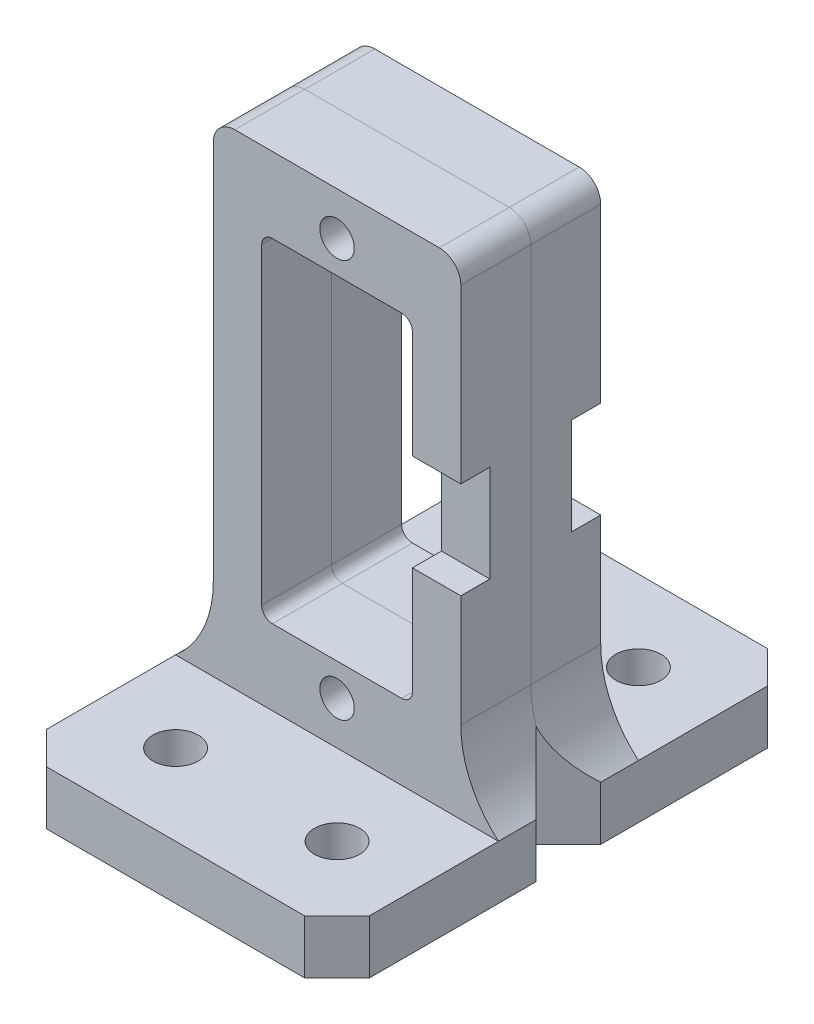
from build123d import *

# Parameters (mm, degrees)
SKETCH_1_W             = 14
SKETCH_1_H             = 31
EXTRUDE_1_DEPTH        = 6.5
SKETCH_2_W             = 30
SKETCH_2_H             = 5
EXTRUDE_2_DEPTH        = 15
SKETCH_3_W             = 4.5
SKETCH_3_H             = 9
CUT_EXTRUDE_1_DEPTH    = 2.7
SKETCH_4_R             = 1.6
CUT_EXTRUDE_2_DEPTH    = 35.731109974
PATTERN_LINEAR_1_COUNT = 2
PATTERN_LINEAR_1_PITCH = 37
SKETCH_5_R             = 2.1
CUT_EXTRUDE_3_DEPTH    = 53.079266508
FILLET_2_R             = 2
FILLET_3_R             = 10
CHAMFER_1_SIZE         = 3
FILLET_4_R             = 1


with BuildPart() as part:
    # 草圖1 → 填料-伸長1 (new body)
    with BuildSketch(Plane.XY):
        Polygon((11.5, -22.5), (11.5, 22.5), (-11.5, 22.5), (-11.5, -22.5), (-15, -22.5), (-15, -27.5), (15, -27.5), (15, -22.5), align=None)
        Rectangle(SKETCH_1_W, SKETCH_1_H, mode=Mode.SUBTRACT)
    extrude(amount=EXTRUDE_1_DEPTH)

    # 草圖2 → 填料-伸長2 (add)
    with BuildSketch(Plane.XY.offset(6.5)):
        with Locations((0, -25)):
            Rectangle(SKETCH_2_W, SKETCH_2_H)
    extrude(amount=EXTRUDE_2_DEPTH)

    # 草圖3 → 除料-伸長1 (cut)
    with BuildSketch(Plane.XY.offset(6.5)):
        with Locations((9.25, 0)):
            Rectangle(SKETCH_3_W, SKETCH_3_H)
    extrude(amount=-CUT_EXTRUDE_1_DEPTH, mode=Mode.SUBTRACT)

    # 草圖4 → 除料-伸長2 (cut, through all)
    with BuildSketch(Plane.XY.offset(6.5)):
        with Locations((0, 18.5)):
            Circle(SKETCH_4_R)
    cut_extrude_2 = extrude(amount=-CUT_EXTRUDE_2_DEPTH, mode=Mode.SUBTRACT)

    # 直線複製排列1: 除料-伸長2 ×2
    with Locations(*[(0, -i * PATTERN_LINEAR_1_PITCH, 0) for i in range(1, PATTERN_LINEAR_1_COUNT)]):
        add(cut_extrude_2, mode=Mode.SUBTRACT)

    # 草圖5 → 除料-伸長3 (cut, through all)
    with BuildSketch(Plane(origin=(0, -22.5, 0), x_dir=(1, 0, 0), z_dir=(0, 1, 0))):
        with Locations(Location((-7.5, -14, 0), (0, 0, 180))):
            Circle(SKETCH_5_R)
        with Locations(Location((7.5, -14, 0), (0, 0, 180))):
            Circle(SKETCH_5_R)
    extrude(amount=-CUT_EXTRUDE_3_DEPTH, mode=Mode.SUBTRACT)

    # 圓角2
    fillet_2_edges = [part.edges().sort_by_distance(p)[0] for p in [
        (-11.5, 22.5, 3.25),
        (11.5, 22.5, 3.25),
    ]]
    fillet(fillet_2_edges, radius=FILLET_2_R)

    # 圓角3
    # the kernel refuses this fillet: 10 mm, written as the material it adds along each edge
    with BuildSketch(Plane(origin=(-11.5, -22.5, 0), x_dir=(-1, 0, 0), z_dir=(0, 0, 1))) as fillet_3_piece_1:
        with BuildLine():
            CenterArc((10, -7.599342077), FILLET_3_R, 130.541601874, 49.458398126)
            Line((0, -7.599342077), (-0.2, -7.599342077))
            Line((-0.2, -7.599342077), (-0.2, 0))
            Line((-0.2, 0), (0, 0.2))
            ThreePointArc((0, 0.2), (1.75, 0.2), (3.37, 0.151986842))
            Line((3.37, 0.151986842), (3.5, 0))
        make_face()
    extrude(amount=6.5)
    with BuildSketch(Plane(origin=(11.5, -22.5, 0), x_dir=(0, 1, 0), z_dir=(0, 0, 1))) as fillet_3_piece_2:
        with BuildLine():
            CenterArc((7.599342077, -10), FILLET_3_R, 90, 49.458398126)
            Line((0, -3.5), (-0.151986842, -3.37))
            ThreePointArc((-0.151986842, -3.37), (-0.2, -1.75), (-0.2, 0))
            Line((-0.2, 0), (0, 0.2))
            Line((0, 0.2), (7.599342077, 0.2))
            Line((7.599342077, 0.2), (7.599342077, 0))
        make_face()
    extrude(amount=6.5)

    # 導角1
    chamfer_1_edges = [part.edges().sort_by_distance(p)[0] for p in [
        (-15, -25, 0),
        (15, -25, 0),
        (-15, -25, 21.5),
        (15, -25, 21.5),
    ]]
    chamfer(chamfer_1_edges, length=CHAMFER_1_SIZE)

    # 圓角4
    fillet_4_edges = [part.edges().sort_by_distance(p)[0] for p in [
        (7, -15.5, 3.25),
        (7, 15.5, 3.25),
        (-7, 15.5, 3.25),
        (-7, -15.5, 3.25),
    ]]
    fillet(fillet_4_edges, radius=FILLET_4_R)

    # 鏡射2: part across plane


with BuildPart() as part_1:
    add(part.part)
    add(part.part.mirror(Plane(origin=(0, 0, 0), x_dir=(1, 0, 0), z_dir=(0, 0, -1))))


with BuildPart() as body_2:
    # Split Bodies 1: the piece on the far side of the plane
    add(part_1.part)
    split(bisect_by=Plane(origin=(0, 0, 0), x_dir=(-1, 0, 0), z_dir=(0, 0, -1)), keep=Keep.BOTTOM)


with BuildPart() as part_2:
    add(part_1.part)

    # Split Bodies 1
    split(bisect_by=Plane(origin=(0, 0, 0), x_dir=(-1, 0, 0), z_dir=(0, 0, -1)), keep=Keep.TOP)


solid = Compound([body_2.part, part_2.part])
